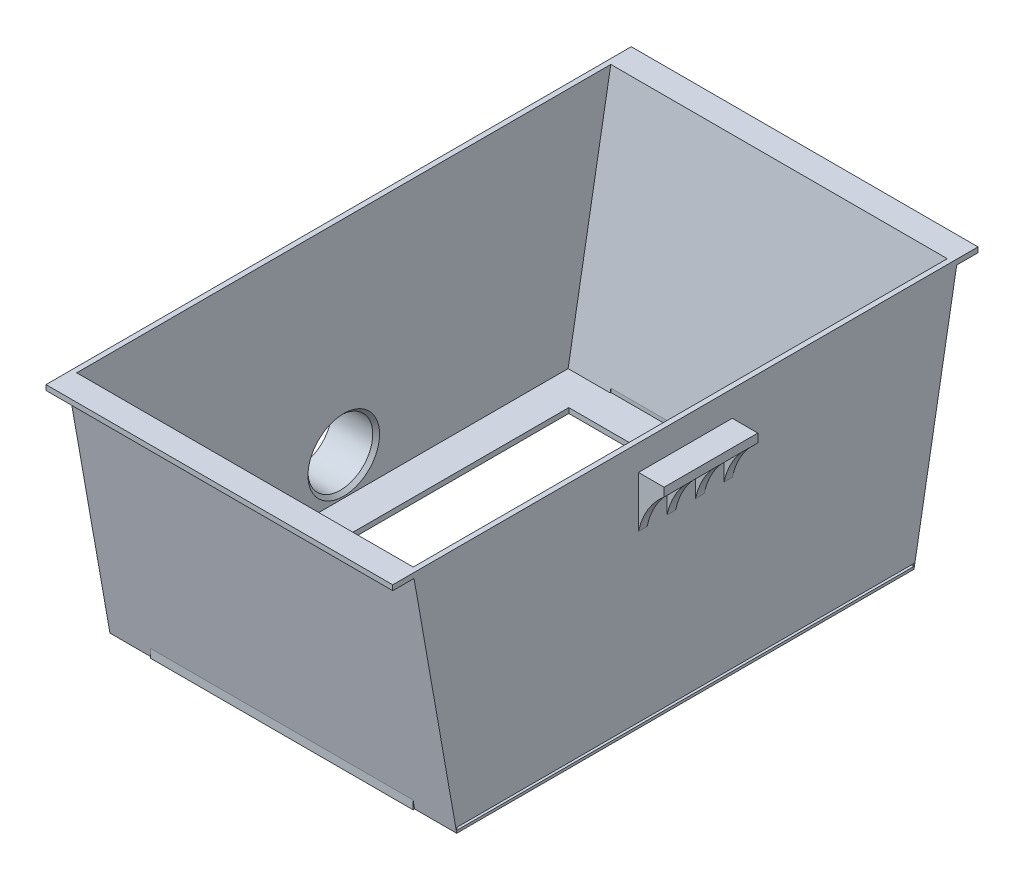
from build123d import *

# Parameters (mm, degrees)
SKETCH1_W                       = 154
SKETCH1_H                       = 270
BOSS_EXTRUDE1_DEPTH             = 140
BOSS_EXTRUDE1_DRAFT             = -10
SKETCH2_W                       = 154
SKETCH2_H                       = 270
BOSS_EXTRUDE2_DEPTH             = 5
BOSS_EXTRUDE3_REACH             = 237.456
BOSS_EXTRUDE3_DIRECTION_2_REACH = 237.456
SHELL1_T                        = -3
SKETCH5_W                       = 15
SKETCH5_H                       = 55
BOSS_EXTRUDE4_DEPTH             = 5
BOSS_EXTRUDE5_DEPTH             = 5
LPATTERN1_COUNT                 = 4
LPATTERN1_PITCH                 = 16.7215
SKETCH7_W                       = 15
SKETCH7_H                       = 0.1645
CUT_EXTRUDE2_DEPTH              = 234.966061846
MIRROR2_START                   = -27.5
MIRROR2_OUTLINE_W               = 15
MIRROR2_OUTLINE_H               = 5
MIRROR2_DEPTH                   = 55
MIRROR2_START_2                 = -10.943
MIRROR2_2_DEPTH                 = 5
MIRROR2_START_3                 = 5.7785
MIRROR2_3_DEPTH                 = 5
MIRROR2_START_4                 = 22.5
MIRROR2_4_DEPTH                 = 5
MIRROR2_5_DEPTH                 = 4.8355
SKETCH8_W                       = 268
SKETCH8_H                       = 1.5
CUT_EXTRUDE3_DEPTH              = 35
SKETCH9_R                       = 19
CUT_EXTRUDE4_DEPTH              = 35
SKETCH10_W                      = 157.371554598
SKETCH10_H                      = 224
CUT_EXTRUDE5_DEPTH              = 35
BOSS_EXTRUDE6_START             = 20
SKETCH11_R                      = 21
SKETCH11_R_2                    = 19
BOSS_EXTRUDE6_DEPTH             = 20
BOSS_EXTRUDE7_START             = 3
SKETCH12_R                      = 29
SKETCH12_R_2                    = 19
BOSS_EXTRUDE7_DEPTH             = 3
CHAMFER1_SIZE                   = 2
BOSS_EXTRUDE8_START             = 137
BOSS_EXTRUDE8_2_OUTLINE_W       = 203.371554598
BOSS_EXTRUDE8_2_OUTLINE_H       = 12.482701107
BOSS_EXTRUDE8_2_DEPTH           = 3


with BuildPart() as part:
    # Sketch1 → Boss-Extrude1 (with draft: the straight prism first)
    with BuildSketch(Plane(origin=(0, 0, 0), x_dir=(1, 0, 0), z_dir=(0, 1, 0))):
        Rectangle(SKETCH1_W, SKETCH1_H)
    extrude(amount=BOSS_EXTRUDE1_DEPTH)
    # Boss-Extrude1: the draft: its side faces are tilted about the plane it starts from
    boss_extrude1_sides = [part.faces().sort_by_distance(p)[0] for p in [
        (-77, 70, 0),
        (0, 70, 135),
        (77, 70, 0),
        (0, 70, -135),
    ]]
    draft(boss_extrude1_sides, Plane(origin=(0, 0, 0), x_dir=(1, 0, 0), z_dir=(0, 1, 0)), BOSS_EXTRUDE1_DRAFT)

    # Sketch2 → Boss-Extrude2 (add)
    with BuildSketch(Plane.XZ):
        Rectangle(SKETCH2_W, SKETCH2_H)
    extrude(amount=BOSS_EXTRUDE2_DEPTH)

    # Boss-Extrude3: up to this plane
    boss_extrude3_end = Plane(origin=(-77, 0, 135), z_dir=(0, -0.17364817766693072, 0.984807753012208))
    # Sketch4 → Boss-Extrude3 (add, up to the surface)
    with BuildSketch(Plane.XY, mode=Mode.PRIVATE) as boss_extrude3_sk1:
        Polygon((101.685777299, -5), (77, -5), (77, 0), (101.685777299, 140), align=None)
    boss_extrude3_tool1 = split(extrude(boss_extrude3_sk1.sketch, amount=BOSS_EXTRUDE3_REACH, mode=Mode.PRIVATE), bisect_by=boss_extrude3_end, keep=Keep.BOTH, mode=Mode.PRIVATE)
    boss_extrude3 = boss_extrude3_tool1.solids().sort_by_distance((93.182898, 43.388889, 0))[0]
    add(boss_extrude3)

    # Boss-Extrude3 direction 2: up to this plane
    boss_extrude3_direction_2_end = Plane(origin=(-77, 0, -135), z_dir=(0, -0.17364817766693072, -0.984807753012208))
    # Sketch4 → Boss-Extrude3 direction 2 (add, up to the surface)
    with BuildSketch(Plane.XY, mode=Mode.PRIVATE) as boss_extrude3_direction_2_sk1:
        Polygon((101.685777299, -5), (77, -5), (77, 0), (101.685777299, 140), align=None)
    boss_extrude3_direction_2_tool1 = split(extrude(boss_extrude3_direction_2_sk1.sketch, amount=-BOSS_EXTRUDE3_DIRECTION_2_REACH, mode=Mode.PRIVATE), bisect_by=boss_extrude3_direction_2_end, keep=Keep.BOTH, mode=Mode.PRIVATE)
    boss_extrude3_direction_2 = boss_extrude3_direction_2_tool1.solids().sort_by_distance((93.182898, 43.388889, 0))[0]
    add(boss_extrude3_direction_2)
    boss_extrude3 = boss_extrude3 + boss_extrude3_direction_2  # both directions under the feature's name, for the pattern or mirror that repeats it

    # Mirror1: Boss-Extrude3 across plane
    add(boss_extrude3.mirror(Plane(origin=(0, 0, 0), x_dir=(0, 0, 1), z_dir=(1, 0, 0))))

    # Shell1
    shell1_openings = [part.faces().sort_by_distance(p)[0] for p in [
        (0, 140, 0),
    ]]
    offset(amount=SHELL1_T, openings=shell1_openings, kind=Kind.INTERSECTION)

    # Sketch5 → Boss-Extrude4 (add)
    with BuildSketch(Plane(origin=(0, 120, 0), x_dir=(1, 0, 0), z_dir=(0, 1, 0))):
        with Locations((109.185777299, 0)):
            Rectangle(SKETCH5_W, SKETCH5_H)
    extrude(amount=BOSS_EXTRUDE4_DEPTH)

    # Sketch6 → Boss-Extrude5 (add)
    with BuildSketch(Plane.XY.offset(27.5)):
        with BuildLine():
            Line((101.685777299, 120), (101.685777299, 95))
            ThreePointArc((101.685777299, 95), (107.105041487, 108.748441487), (116.685777299, 120))
            Line((116.685777299, 120), (101.685777299, 120))
        make_face()
    boss_extrude5 = extrude(amount=-BOSS_EXTRUDE5_DEPTH)

    # LPattern1: Boss-Extrude5 ×4
    with Locations(*[(0, 0, -i * LPATTERN1_PITCH) for i in range(1, LPATTERN1_COUNT)]):
        add(boss_extrude5)

    # Sketch7 → Cut-Extrude2 (cut, through all)
    with BuildSketch(Plane(origin=(0, 120, 0), x_dir=(1, 0, 0), z_dir=(0, 1, 0))):
        with Locations((109.185777299, 27.58225)):
            Rectangle(SKETCH7_W, SKETCH7_H)
    extrude(amount=-CUT_EXTRUDE2_DEPTH, mode=Mode.SUBTRACT)

    # Mirror2: read off the stored shape, not the designer's step
    # Mirror2 outline → Mirror2 (add)
    with BuildSketch(Plane.XY.offset(MIRROR2_START)):
        with Locations((-109.185777299, 122.5)):
            Rectangle(MIRROR2_OUTLINE_W, MIRROR2_OUTLINE_H)
    extrude(amount=MIRROR2_DEPTH)

    # Mirror2 2 outline → Mirror2 2 (add)
    with BuildSketch(Plane.XY.offset(MIRROR2_START_2)):
        with BuildLine():
            ThreePointArc((-116.685777299, 120), (-107.105041487, 108.748441487), (-101.685777299, 95))
            Line((-101.685777299, 95), (-101.685777299, 120))
            Line((-101.685777299, 120), (-116.685777299, 120))
        make_face()
    extrude(amount=MIRROR2_2_DEPTH)

    # Mirror2 3 outline → Mirror2 3 (add)
    with BuildSketch(Plane.XY.offset(MIRROR2_START_3)):
        with BuildLine():
            ThreePointArc((-116.685777299, 120), (-107.105041487, 108.748441487), (-101.685777299, 95))
            Line((-101.685777299, 95), (-101.685777299, 120))
            Line((-101.685777299, 120), (-116.685777299, 120))
        make_face()
    extrude(amount=MIRROR2_3_DEPTH)

    # Mirror2 4 outline → Mirror2 4 (add)
    with BuildSketch(Plane.XY.offset(MIRROR2_START_4)):
        with BuildLine():
            ThreePointArc((-116.685777299, 120), (-107.105041487, 108.748441487), (-101.685777299, 95))
            Line((-101.685777299, 95), (-101.685777299, 120))
            Line((-101.685777299, 120), (-116.685777299, 120))
        make_face()
    extrude(amount=MIRROR2_4_DEPTH)

    # Mirror2 5 outline → Mirror2 5 (add)
    with BuildSketch(Plane.XY.offset(MIRROR2_START)):
        with BuildLine():
            ThreePointArc((-116.685777299, 120), (-107.105041487, 108.748441487), (-101.685777299, 95))
            Line((-101.685777299, 95), (-101.685777299, 120))
            Line((-101.685777299, 120), (-116.685777299, 120))
        make_face()
    extrude(amount=MIRROR2_5_DEPTH)

    # Sketch8 → Cut-Extrude3 (cut)
    with BuildSketch(Plane(origin=(101.685777299, 0, 0), x_dir=(0, 0, -1), z_dir=(1, 0, 0))):
        with Locations((0, -2.75)):
            Rectangle(SKETCH8_W, SKETCH8_H)
    extrude(amount=-CUT_EXTRUDE3_DEPTH, mode=Mode.SUBTRACT)

    # Sketch9 → Cut-Extrude4 (cut)
    with BuildSketch(Plane.ZY.offset(101.685777299)):
        with Locations(Location((0, 20, 0), (0, 0, 270))):
            Circle(SKETCH9_R)
    extrude(amount=-CUT_EXTRUDE4_DEPTH, mode=Mode.SUBTRACT)

    # Sketch10 → Cut-Extrude5 (cut)
    with BuildSketch(Plane(origin=(0, -2, 0), x_dir=(1, 0, 0), z_dir=(0, 1, 0))):
        Rectangle(SKETCH10_W, SKETCH10_H)
    extrude(amount=-CUT_EXTRUDE5_DEPTH, mode=Mode.SUBTRACT)

    # Sketch11 → Boss-Extrude6 (add)
    with BuildSketch(Plane.ZY.offset(101.685777299).offset(BOSS_EXTRUDE6_START)):
        with Locations(Location((0, 20, 0), (0, 0, 90))):
            Circle(SKETCH11_R)
        with Locations(Location((0, 20, 0), (0, 0, 270))):
            Circle(SKETCH11_R_2, mode=Mode.SUBTRACT)
    extrude(amount=-BOSS_EXTRUDE6_DEPTH)

    # Sketch12 → Boss-Extrude7 (add)
    with BuildSketch(Plane.ZY.offset(121.685777299).offset(BOSS_EXTRUDE7_START)):
        with Locations(Location((0, 20, 0), (0, 0, 270))):
            Circle(SKETCH12_R)
        with Locations(Location((0, 20, 0), (0, 0, 270))):
            Circle(SKETCH12_R_2, mode=Mode.SUBTRACT)
    extrude(amount=-BOSS_EXTRUDE7_DEPTH)

    # Chamfer1
    chamfer1_edges = [part.edges().sort_by_distance(p)[0] for p in [
        (-98.685777299, 39, 0),
    ]]
    chamfer(chamfer1_edges, length=CHAMFER1_SIZE)

    # Boss-Extrude8: read off the stored shape, not the designer's step
    # Boss-Extrude8 outline → Boss-Extrude8 (revolve)
    with BuildSketch(Plane(origin=(0, 20, 0), x_dir=(0, 1, 0), z_dir=(0, 0, -1))):
        Polygon((23, -121.685777299), (21, -119.685777299), (21, -121.685777299), align=None)
        Polygon((21, -101.685777299), (21, -103.685777299), (23, -101.685777299), align=None)
    boss_extrude8 = revolve(axis=Axis((0, 20, 0), (1, 0, 0)))

    # Boss-Extrude8 2 outline → Boss-Extrude8 2 (add)
    with BuildSketch(Plane(origin=(0, 0, 0), x_dir=(1, 0, 0), z_dir=(0, 1, 0)).offset(BOSS_EXTRUDE8_START)):
        with Locations((0, -165.398146911)):
            Rectangle(BOSS_EXTRUDE8_2_OUTLINE_W, BOSS_EXTRUDE8_2_OUTLINE_H)
    boss_extrude8_2 = extrude(amount=BOSS_EXTRUDE8_2_DEPTH)

    # Mirror3: Boss-Extrude8, Boss-Extrude8 2 across plane
    add(boss_extrude8.mirror(Plane.XY))
    add(boss_extrude8_2.mirror(Plane.XY))


solid = part.part
